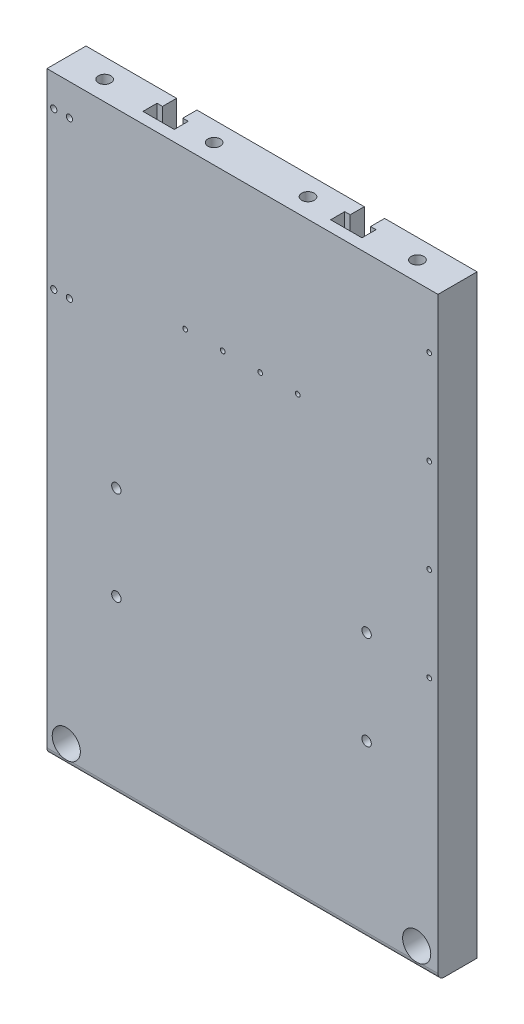
from build123d import *

# Parameters (mm, degrees)
SKETCH_1_W          = 250
SKETCH_1_H          = 380
SKETCH_1_R          = 9
SKETCH_1_R_2        = 2
SKETCH_1_R_3        = 1.5
SKETCH_1_R_4        = 3
EXTRUDE_3_DEPTH     = 25
CUT_EXTRUDE_1_DEPTH = 416
SKETCH_3_4_R        = 4
CUT_EXTRUDE_2_DEPTH = 55
SKETCH_5_W          = 76.418543054
SKETCH_5_H          = 18.162254628
EXTRUDE_4_DEPTH     = 12
SKETCH_6_W          = 9.937837438
SKETCH_6_H          = 197.728696601
EXTRUDE_5_DEPTH     = 12
SKETCH_7_W          = 21.060874429
SKETCH_7_H          = 111.734651623
EXTRUDE_6_DEPTH     = 12
SKETCH_8_W          = 15.76346628
SKETCH_8_H          = 76.418543054
EXTRUDE_7_DEPTH     = 5
SKETCH_9_W          = 10.965889587
SKETCH_9_H          = 75.390490905
EXTRUDE_8_DEPTH     = 5
SKETCH_10_W         = 21.30480461
SKETCH_10_H         = 26.996927979
SKETCH_10_R         = 6
EXTRUDE_11_DEPTH    = 11
FILLET_1_R          = 4


with BuildPart() as part:
    # 草图1 → 凸台-拉伸3 (new body)
    with BuildSketch(Plane.XY):
        with Locations((125.613842041, 190.076299127)):
            Rectangle(SKETCH_1_W, SKETCH_1_H)
        with Locations((13, 12.5)):
            Circle(SKETCH_1_R, mode=Mode.SUBTRACT)
        with Locations((237, 12.5)):
            Circle(SKETCH_1_R, mode=Mode.SUBTRACT)
        with Locations((5, 360)):
            Circle(SKETCH_1_R_2, mode=Mode.SUBTRACT)
        with Locations((5, 260)):
            Circle(SKETCH_1_R_2, mode=Mode.SUBTRACT)
        with Locations((15, 360)):
            Circle(SKETCH_1_R_2, mode=Mode.SUBTRACT)
        with Locations((15, 260)):
            Circle(SKETCH_1_R_2, mode=Mode.SUBTRACT)
        with Locations((89, 280)):
            Circle(SKETCH_1_R_3, mode=Mode.SUBTRACT)
        with Locations((113, 280)):
            Circle(SKETCH_1_R_3, mode=Mode.SUBTRACT)
        with Locations((137, 280)):
            Circle(SKETCH_1_R_3, mode=Mode.SUBTRACT)
        with Locations((161, 280)):
            Circle(SKETCH_1_R_3, mode=Mode.SUBTRACT)
        with Locations((45, 110)):
            Circle(SKETCH_1_R_4, mode=Mode.SUBTRACT)
        with Locations((45, 170)):
            Circle(SKETCH_1_R_4, mode=Mode.SUBTRACT)
        with Locations((205, 170)):
            Circle(SKETCH_1_R_4, mode=Mode.SUBTRACT)
        with Locations((205, 110)):
            Circle(SKETCH_1_R_4, mode=Mode.SUBTRACT)
        with Locations((245, 345)):
            Circle(SKETCH_1_R_3, mode=Mode.SUBTRACT)
        with Locations((245, 285)):
            Circle(SKETCH_1_R_3, mode=Mode.SUBTRACT)
        with Locations((245, 225)):
            Circle(SKETCH_1_R_3, mode=Mode.SUBTRACT)
        with Locations((245, 165)):
            Circle(SKETCH_1_R_3, mode=Mode.SUBTRACT)
    extrude(amount=EXTRUDE_3_DEPTH)

    # 草图3 → 切除-拉伸1 (cut)
    with BuildSketch(Plane(origin=(0, 380.076299127, 0), x_dir=(1, 0, 0), z_dir=(0, 1, 0))):
        Polygon((71.5, -9), (71.5, 0), (58.5, 0), (58.5, -9), (55, -9), (55, -18), (75, -18), (75, -9), align=None)
        Polygon((191.5, 0), (178.5, 0), (178.5, -9), (175, -9), (175, -18), (195, -18), (195, -9), (191.5, -9), align=None)
    extrude(amount=-CUT_EXTRUDE_1_DEPTH, mode=Mode.SUBTRACT)

    # 草图3<4> → 切除-拉伸2 (cut)
    with BuildSketch(Plane(origin=(0, 380.076299127, 0), x_dir=(1, 0, 0), z_dir=(0, 1, 0))):
        with Locations(Location((95, -12.5, 0), (0, 0, 270))):
            Circle(SKETCH_3_4_R)
        with Locations(Location((155, -12.5, 0), (0, 0, 270))):
            Circle(SKETCH_3_4_R)
        with Locations(Location((225, -12.5, 0), (0, 0, 270))):
            Circle(SKETCH_3_4_R)
        with Locations(Location((25, -12.5, 0), (0, 0, 270))):
            Circle(SKETCH_3_4_R)
    extrude(amount=-CUT_EXTRUDE_2_DEPTH, mode=Mode.SUBTRACT)

    # 草图5 → 凸台-拉伸4 (add)
    with BuildSketch(Plane(origin=(0, 0, 0), x_dir=(-1, 0, 0), z_dir=(0, 0, -1))):
        with Locations((-124.414447867, 279.859520114)):
            Rectangle(SKETCH_5_W, SKETCH_5_H)
    extrude(amount=-EXTRUDE_4_DEPTH)

    # 草图6 → 凸台-拉伸5 (add)
    with BuildSketch(Plane(origin=(0, 0, 0), x_dir=(-1, 0, 0), z_dir=(0, 0, -1))):
        with Locations((-244.34867248, 253.130164248)):
            Rectangle(SKETCH_6_W, SKETCH_6_H)
    extrude(amount=-EXTRUDE_5_DEPTH)

    # 草图7 → 凸台-拉伸6 (add)
    with BuildSketch(Plane(origin=(0, 0, 0), x_dir=(-1, 0, 0), z_dir=(0, 0, -1))):
        with Locations((-11.144279256, 310.45109449)):
            Rectangle(SKETCH_7_W, SKETCH_7_H)
    extrude(amount=-EXTRUDE_6_DEPTH)

    # 草图8 → 凸台-拉伸7 (add)
    with BuildSketch(Plane(origin=(0, 0, 0), x_dir=(-1, 0, 0), z_dir=(0, 0, -1))):
        with Locations((-204.431173441, 138.673691692)):
            Rectangle(SKETCH_8_W, SKETCH_8_H)
    extrude(amount=-EXTRUDE_7_DEPTH)

    # 草图9 → 凸台-拉伸8 (add)
    with BuildSketch(Plane(origin=(0, 0, 0), x_dir=(-1, 0, 0), z_dir=(0, 0, -1))):
        with Locations((-45.425774442, 139.530401815)):
            Rectangle(SKETCH_9_W, SKETCH_9_H)
    extrude(amount=-EXTRUDE_8_DEPTH)

    # 草图10 → 凸台-拉伸11 (add)
    # profile 1 of 2: a face of its own
    with BuildSketch(Plane(origin=(0, 0, 0), x_dir=(-1, 0, 0), z_dir=(0, 0, -1))):
        with Locations((-236.946967286, 15.123600302)):
            Rectangle(SKETCH_10_W, SKETCH_10_H)
        with Locations((-237, 12.5)):
            Circle(SKETCH_10_R, mode=Mode.SUBTRACT)
    # profile 2 of 2: a face of its own
    with BuildSketch(Plane(origin=(0, 0, 0), x_dir=(-1, 0, 0), z_dir=(0, 0, -1))):
        with Locations((-13.053032714, 15.123600302)):
            Rectangle(SKETCH_10_W, SKETCH_10_H)
        with Locations((-13, 12.5)):
            Circle(SKETCH_10_R, mode=Mode.SUBTRACT)
    extrude(amount=-EXTRUDE_11_DEPTH)

    # 圆角1
    # the kernel refuses this fillet: 4 mm, written as the material it takes off along each edge
    with BuildSketch(Plane(origin=(-9.386157959, 0.076299127, 25), x_dir=(0, 0, -1), z_dir=(1, 0, 0))) as fillet_1_piece_1:
        with BuildLine():
            CenterArc((FILLET_1_R, FILLET_1_R), FILLET_1_R, 180, 90)
            Line((0, FILLET_1_R), (0, 0))
            Line((0, 0), (FILLET_1_R, 0))
        make_face()
    extrude(amount=270, mode=Mode.SUBTRACT)


solid = part.part
